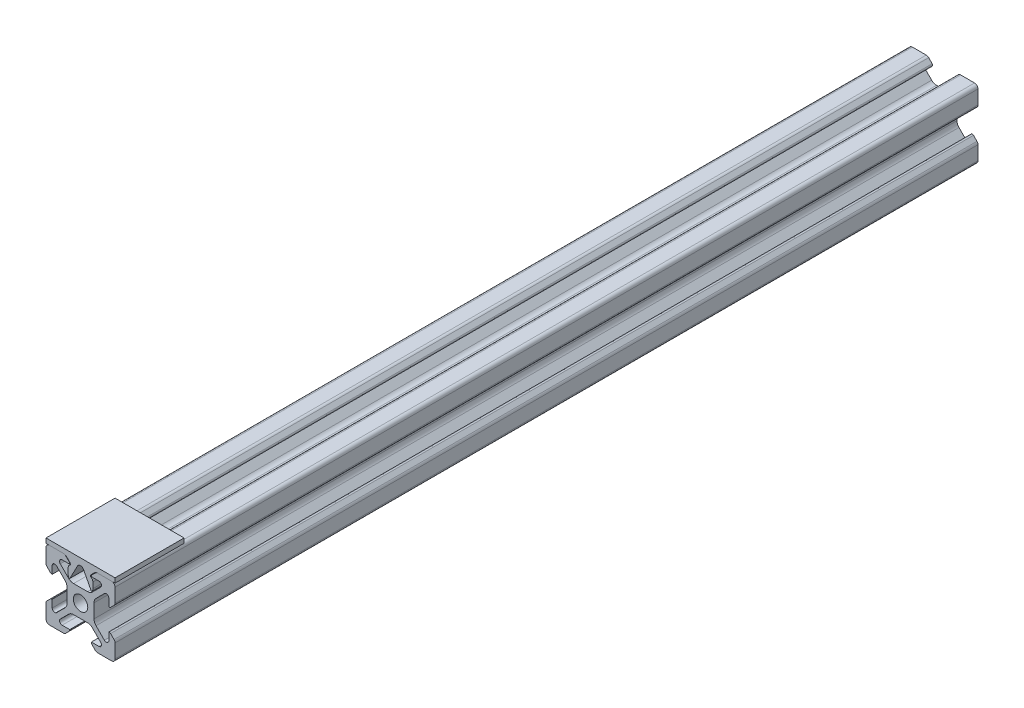
from build123d import *

# Parameters (mm, degrees)
SKETCH_1_R          = 2.1
EXTRUDE_1_DEPTH     = 250
BOSS_EXTRUDE1_DEPTH = 20
MOVE_START          = 230
MOVE_FACE1_DEPTH    = 20
MOVE_FACE2_DEPTH    = 20
MOVE_FACE3_BY       = 0.15
MOVE_FACE3_2_BY     = 0.15
MOVE_FACE3_3_BY     = 0.15
MOVE_FACE3_4_BY     = 0.15
MOVE_FACE3_5_BY     = 0.15
MOVE_FACE3_6_BY     = 0.15
MOVE_FACE3_7_BY     = 0.15
MOVE_FACE3_8_BY     = 0.15
FILLET1_R           = 1
FILLET2_R           = 0.2
FILLET3_R           = 1.6
FILLET4_R           = 1


with BuildPart() as part:
    # Эскиз1 → Бобышка-Вытянуть1 (new body)
    with BuildSketch(Plane.XY):
        with BuildLine():
            Line((3.125, 8.342893219), (3.125, 8.2))
            Line((3.125, 8.2), (5.328679656, 8.2))
            ThreePointArc((5.328679656, 8.2), (6.021589306, 7.737012574), (5.859009742, 6.919669914))
            Line((5.859009742, 6.919669914), (3.425126266, 4.485786438))
            ThreePointArc((3.425126266, 4.485786438), (2.776279568, 4.052240935), (2.010912703, 3.9))
            Line((2.010912703, 3.9), (-2.010912703, 3.9))
            ThreePointArc((-2.010912703, 3.9), (-2.776279568, 4.052240935), (-3.425126266, 4.485786438))
            Line((-3.425126266, 4.485786438), (-5.859009742, 6.919669914))
            ThreePointArc((-5.859009742, 6.919669914), (-6.021589306, 7.737012574), (-5.328679656, 8.2))
            Line((-5.328679656, 8.2), (-3.125, 8.2))
            Line((-3.125, 8.2), (-3.125, 8.342893219))
            ThreePointArc((-3.125, 8.342893219), (-3.163060234, 8.534234935), (-3.271446609, 8.696446609))
            Line((-3.271446609, 8.696446609), (-4.282106781, 9.707106781))
            ThreePointArc((-4.282106781, 9.707106781), (-4.60653013, 9.923879533), (-4.989213562, 10))
            Line((-4.989213562, 10), (-9, 10))
            ThreePointArc((-9, 10), (-9.707106781, 9.707106781), (-10, 9))
            Line((-10, 9), (-10, 4.989213562))
            ThreePointArc((-10, 4.989213562), (-9.923879533, 4.60653013), (-9.707106781, 4.282106781))
            Line((-9.707106781, 4.282106781), (-8.696446609, 3.271446609))
            ThreePointArc((-8.696446609, 3.271446609), (-8.534234935, 3.163060234), (-8.342893219, 3.125))
            Line((-8.342893219, 3.125), (-8.2, 3.125))
            Line((-8.2, 3.125), (-8.2, 5.328679656))
            ThreePointArc((-8.2, 5.328679656), (-7.737012574, 6.021589306), (-6.919669914, 5.859009742))
            Line((-6.919669914, 5.859009742), (-4.485786438, 3.425126266))
            ThreePointArc((-4.485786438, 3.425126266), (-4.052240935, 2.776279568), (-3.9, 2.010912703))
            Line((-3.9, 2.010912703), (-3.9, -2.010912703))
            ThreePointArc((-3.9, -2.010912703), (-4.052240935, -2.776279568), (-4.485786438, -3.425126266))
            Line((-4.485786438, -3.425126266), (-6.919669914, -5.859009742))
            ThreePointArc((-6.919669914, -5.859009742), (-7.737012574, -6.021589306), (-8.2, -5.328679656))
            Line((-8.2, -5.328679656), (-8.2, -3.125))
            Line((-8.2, -3.125), (-8.342893219, -3.125))
            ThreePointArc((-8.342893219, -3.125), (-8.534234935, -3.163060234), (-8.696446609, -3.271446609))
            Line((-8.696446609, -3.271446609), (-9.707106781, -4.282106781))
            ThreePointArc((-9.707106781, -4.282106781), (-9.923879533, -4.60653013), (-10, -4.989213562))
            Line((-10, -4.989213562), (-10, -9))
            ThreePointArc((-10, -9), (-9.707106781, -9.707106781), (-9, -10))
            Line((-9, -10), (-4.989213562, -10))
            ThreePointArc((-4.989213562, -10), (-4.60653013, -9.923879533), (-4.282106781, -9.707106781))
            Line((-4.282106781, -9.707106781), (-3.271446609, -8.696446609))
            ThreePointArc((-3.271446609, -8.696446609), (-3.163060234, -8.534234935), (-3.125, -8.342893219))
            Line((-3.125, -8.342893219), (-3.125, -8.2))
            Line((-3.125, -8.2), (-5.328679656, -8.2))
            ThreePointArc((-5.328679656, -8.2), (-6.021589306, -7.737012574), (-5.859009742, -6.919669914))
            Line((-5.859009742, -6.919669914), (-3.425126266, -4.485786438))
            ThreePointArc((-3.425126266, -4.485786438), (-2.776279568, -4.052240935), (-2.010912703, -3.9))
            Line((-2.010912703, -3.9), (2.010912703, -3.9))
            ThreePointArc((2.010912703, -3.9), (2.776279568, -4.052240935), (3.425126266, -4.485786438))
            Line((3.425126266, -4.485786438), (5.859009742, -6.919669914))
            ThreePointArc((5.859009742, -6.919669914), (6.021589306, -7.737012574), (5.328679656, -8.2))
            Line((5.328679656, -8.2), (3.125, -8.2))
            Line((3.125, -8.2), (3.125, -8.342893219))
            ThreePointArc((3.125, -8.342893219), (3.163060234, -8.534234935), (3.271446609, -8.696446609))
            Line((3.271446609, -8.696446609), (4.282106781, -9.707106781))
            ThreePointArc((4.282106781, -9.707106781), (4.60653013, -9.923879533), (4.989213562, -10))
            Line((4.989213562, -10), (9, -10))
            ThreePointArc((9, -10), (9.707106781, -9.707106781), (10, -9))
            Line((10, -9), (10, -4.989213562))
            ThreePointArc((10, -4.989213562), (9.923879533, -4.60653013), (9.707106781, -4.282106781))
            Line((9.707106781, -4.282106781), (8.696446609, -3.271446609))
            ThreePointArc((8.696446609, -3.271446609), (8.534234935, -3.163060234), (8.342893219, -3.125))
            Line((8.342893219, -3.125), (8.2, -3.125))
            Line((8.2, -3.125), (8.2, -5.328679656))
            ThreePointArc((8.2, -5.328679656), (7.737012574, -6.021589306), (6.919669914, -5.859009742))
            Line((6.919669914, -5.859009742), (4.485786438, -3.425126266))
            ThreePointArc((4.485786438, -3.425126266), (4.052240935, -2.776279568), (3.9, -2.010912703))
            Line((3.9, -2.010912703), (3.9, 2.010912703))
            ThreePointArc((3.9, 2.010912703), (4.052240935, 2.776279568), (4.485786438, 3.425126266))
            Line((4.485786438, 3.425126266), (6.919669914, 5.859009742))
            ThreePointArc((6.919669914, 5.859009742), (7.737012574, 6.021589306), (8.2, 5.328679656))
            Line((8.2, 5.328679656), (8.2, 3.125))
            Line((8.2, 3.125), (8.342893219, 3.125))
            ThreePointArc((8.342893219, 3.125), (8.534234935, 3.163060234), (8.696446609, 3.271446609))
            Line((8.696446609, 3.271446609), (9.707106781, 4.282106781))
            ThreePointArc((9.707106781, 4.282106781), (9.923879533, 4.60653013), (10, 4.989213562))
            Line((10, 4.989213562), (10, 9))
            ThreePointArc((10, 9), (9.707106781, 9.707106781), (9, 10))
            Line((9, 10), (4.989213562, 10))
            ThreePointArc((4.989213562, 10), (4.60653013, 9.923879533), (4.282106781, 9.707106781))
            Line((4.282106781, 9.707106781), (3.271446609, 8.696446609))
            ThreePointArc((3.271446609, 8.696446609), (3.163060234, 8.534234935), (3.125, 8.342893219))
        make_face()
        Circle(SKETCH_1_R, mode=Mode.SUBTRACT)
    extrude(amount=EXTRUDE_1_DEPTH)


with BuildPart() as body_2:
    # Sketch1 → Boss-Extrude1 (new body)
    with BuildSketch(Plane.XY.offset(250)):
        with BuildLine():
            Line((-9, 10), (-10, 10))
            Line((-10, 10), (-10, 11.35))
            Line((-10, 11.35), (10, 11.35))
            Line((10, 11.35), (10, 10))
            Line((10, 10), (9, 10))
            Line((9, 10), (4.989213562, 10))
            ThreePointArc((4.989213562, 10), (4.60653013, 9.923879533), (4.282106781, 9.707106781))
            Line((4.282106781, 9.707106781), (3.271446609, 8.696446609))
            ThreePointArc((3.271446609, 8.696446609), (3.163060234, 8.534234935), (3.125, 8.342893219))
            Line((3.125, 8.342893219), (3.125, 8.2))
            Line((3.125, 8.2), (3.725, 8.2))
            Line((3.725, 8.2), (3.725, 4.785660172))
            Line((3.725, 4.785660172), (3.425126266, 4.485786438))
            ThreePointArc((3.425126266, 4.485786438), (3.33984567, 4.405363867), (3.25, 4.330075584))
            Line((3.25, 4.330075584), (0, 10.55))
            Line((0, 10.55), (-3.25, 4.330075584))
            ThreePointArc((-3.25, 4.330075584), (-3.33984567, 4.405363867), (-3.425126266, 4.485786438))
            Line((-3.425126266, 4.485786438), (-3.725, 4.785660172))
            Line((-3.725, 4.785660172), (-3.725, 8.2))
            Line((-3.725, 8.2), (-3.125, 8.2))
            Line((-3.125, 8.2), (-3.125, 8.342893219))
            ThreePointArc((-3.125, 8.342893219), (-3.163060234, 8.534234935), (-3.271446609, 8.696446609))
            Line((-3.271446609, 8.696446609), (-4.282106781, 9.707106781))
            ThreePointArc((-4.282106781, 9.707106781), (-4.60653013, 9.923879533), (-4.989213562, 10))
            Line((-4.989213562, 10), (-9, 10))
        make_face()
    extrude(amount=-BOSS_EXTRUDE1_DEPTH)

    # Move Face1: read off the stored shape, not the designer's step
    # Move Face1 outline → Move Face1 (cut)
    with BuildSketch(Plane.XY.offset(MOVE_START)):
        with BuildLine():
            Line((-3.125, 8.2), (-2.945, 8.2))
            Line((-2.945, 8.2), (-2.945, 8.342893219))
            ThreePointArc((-2.945, 8.342893219), (-2.983060234, 8.534234935), (-3.091446609, 8.696446609))
            Line((-3.091446609, 8.696446609), (-4.102106781, 9.707106781))
            ThreePointArc((-4.102106781, 9.707106781), (-4.42653013, 9.923879533), (-4.809213562, 10))
            Line((-4.809213562, 10), (-4.989213562, 10))
            ThreePointArc((-4.989213562, 10), (-4.60653013, 9.923879533), (-4.282106781, 9.707106781))
            Line((-4.282106781, 9.707106781), (-3.271446609, 8.696446609))
            ThreePointArc((-3.271446609, 8.696446609), (-3.163060234, 8.534234935), (-3.125, 8.342893219))
            Line((-3.125, 8.342893219), (-3.125, 8.2))
        make_face()
    extrude(amount=MOVE_FACE1_DEPTH, mode=Mode.SUBTRACT)

    # Move Face2: read off the stored shape, not the designer's step
    # Move Face2 outline → Move Face2 (cut)
    with BuildSketch(Plane.XY.offset(MOVE_START)):
        with BuildLine():
            Line((4.989213562, 10), (4.809213562, 10))
            ThreePointArc((4.809213562, 10), (4.42653013, 9.923879533), (4.102106781, 9.707106781))
            Line((4.102106781, 9.707106781), (3.091446609, 8.696446609))
            ThreePointArc((3.091446609, 8.696446609), (2.983060234, 8.534234935), (2.945, 8.342893219))
            Line((2.945, 8.342893219), (2.945, 8.2))
            Line((2.945, 8.2), (3.125, 8.2))
            Line((3.125, 8.2), (3.125, 8.342893219))
            ThreePointArc((3.125, 8.342893219), (3.163060234, 8.534234935), (3.271446609, 8.696446609))
            Line((3.271446609, 8.696446609), (4.282106781, 9.707106781))
            ThreePointArc((4.282106781, 9.707106781), (4.60653013, 9.923879533), (4.989213562, 10))
        make_face()
    extrude(amount=MOVE_FACE2_DEPTH, mode=Mode.SUBTRACT)

    # Move Face3: a face moved inward by 0.15
    extrude(body_2.faces().sort_by_distance((3.335, 8.2, 240))[0], amount=MOVE_FACE3_BY, dir=(0, -1, 0), mode=Mode.SUBTRACT)

    # Move Face3 2: a face moved inward by 0.15
    extrude(body_2.faces().sort_by_distance((-3.335, 8.2, 240))[0], amount=MOVE_FACE3_2_BY, dir=(0, -1, 0), mode=Mode.SUBTRACT)

    # Move Face3 3: a face moved inward by 0.15
    extrude(body_2.faces().sort_by_distance((3.725, 6.492830086, 240))[0], amount=MOVE_FACE3_3_BY, dir=(-1, 0, 0), mode=Mode.SUBTRACT)

    # Move Face3 4: a curved face moved inward by 0.15
    add(Solid.thicken(body_2.faces().sort_by_distance((3.33984567, 4.405363867, 240))[0], -MOVE_FACE3_4_BY), mode=Mode.SUBTRACT)

    # Move Face3 5: a face moved inward by 0.15
    extrude(body_2.faces().sort_by_distance((3.575063133, 4.635723305, 240))[0], amount=MOVE_FACE3_5_BY, dir=(-0.707106781, 0.707106781, 0), mode=Mode.SUBTRACT)

    # Move Face3 6: a curved face moved inward by 0.15
    add(Solid.thicken(body_2.faces().sort_by_distance((-3.33984567, 4.405363867, 240))[0], -MOVE_FACE3_6_BY), mode=Mode.SUBTRACT)

    # Move Face3 7: a face moved inward by 0.15
    extrude(body_2.faces().sort_by_distance((-3.575063133, 4.635723305, 240))[0], amount=MOVE_FACE3_7_BY, dir=(0.707106781, 0.707106781, 0), mode=Mode.SUBTRACT)

    # Move Face3 8: a face moved inward by 0.15
    extrude(body_2.faces().sort_by_distance((-3.725, 6.492830086, 240))[0], amount=MOVE_FACE3_8_BY, dir=(1, 0, 0), mode=Mode.SUBTRACT)

    # Fillet1
    # the kernel refuses this fillet: 1 mm, written as the material it takes off along each edge
    with BuildSketch(Plane(origin=(3.575, 8.05, 252.322579385), x_dir=(0, -1, 0), z_dir=(0, 0, -1))) as fillet1_piece_1:
        with BuildLine():
            CenterArc((0.929031754, 1), FILLET1_R, 201.715617283, 68.284382717)
            Line((0, 0.63), (-0.018580635, 0.6226))
            ThreePointArc((-0.018580635, 0.6226), (-0.02, 0.315), (-0.02, 0))
            Line((-0.02, 0), (0, -0.02))
            Line((0, -0.02), (0.929031754, -0.02))
            Line((0.929031754, -0.02), (0.929031754, 0))
        make_face()
    extrude(amount=24.64515877, mode=Mode.SUBTRACT)
    with BuildSketch(Plane(origin=(-3.575, 8.05, 252.322579385), x_dir=(1, 0, 0), z_dir=(0, 0, -1))) as fillet1_piece_2:
        with BuildLine():
            CenterArc((1, 0.929031754), FILLET1_R, 180, 68.284382717)
            Line((0, 0.929031754), (-0.02, 0.929031754))
            Line((-0.02, 0.929031754), (-0.02, 0))
            Line((-0.02, 0), (0, -0.02))
            ThreePointArc((0, -0.02), (0.315, -0.02), (0.6226, -0.018580635))
            Line((0.6226, -0.018580635), (0.63, 0))
        make_face()
    extrude(amount=24.64515877, mode=Mode.SUBTRACT)

    # Fillet2
    fillet2_edges = [body_2.edges().sort_by_distance(p)[0] for p in [
        (3.179203519, 4.46556751, 240),
        (-3.179203519, 4.46556751, 240),
    ]]
    fillet(fillet2_edges, radius=FILLET2_R)

    # Fillet3
    # the kernel refuses this fillet: 1.6 mm, written as the material it takes off along each edge
    with BuildSketch(Plane(origin=(3.575, 4.847792206, 251.433598548), x_dir=(-0.7071067812067597, -0.7071067811663352, 0), z_dir=(0, 0, -1))) as fillet3_piece_1:
        with BuildLine():
            CenterArc((0.725887948, 1.536853752), FILLET3_R, 224.999999998, 28.849342749)
            Line((-0.405482902, 0.405482902), (0, 0))
            Line((0, 0), (0.280825542, 0))
        make_face()
    extrude(amount=22.867197096, mode=Mode.SUBTRACT)
    with BuildSketch(Plane(origin=(-3.575, 4.847792206, 251.433598548), x_dir=(0.7071067812067448, -0.7071067811663502, 0), z_dir=(0, 0, -1))) as fillet3_piece_2:
        with BuildLine():
            CenterArc((0.725887948, -1.536853752), FILLET3_R, 106.150657252, 28.849342749)
            Line((-0.405482902, -0.405482902), (0, 0))
            Line((0, 0), (0.280825542, 0))
        make_face()
    extrude(amount=22.867197096, mode=Mode.SUBTRACT)

    # Fillet4
    fillet4_edges = [body_2.edges().sort_by_distance(p)[0] for p in [
        (0, 10.55, 240),
    ]]
    fillet(fillet4_edges, radius=FILLET4_R)


solid = Compound([part.part, body_2.part])
